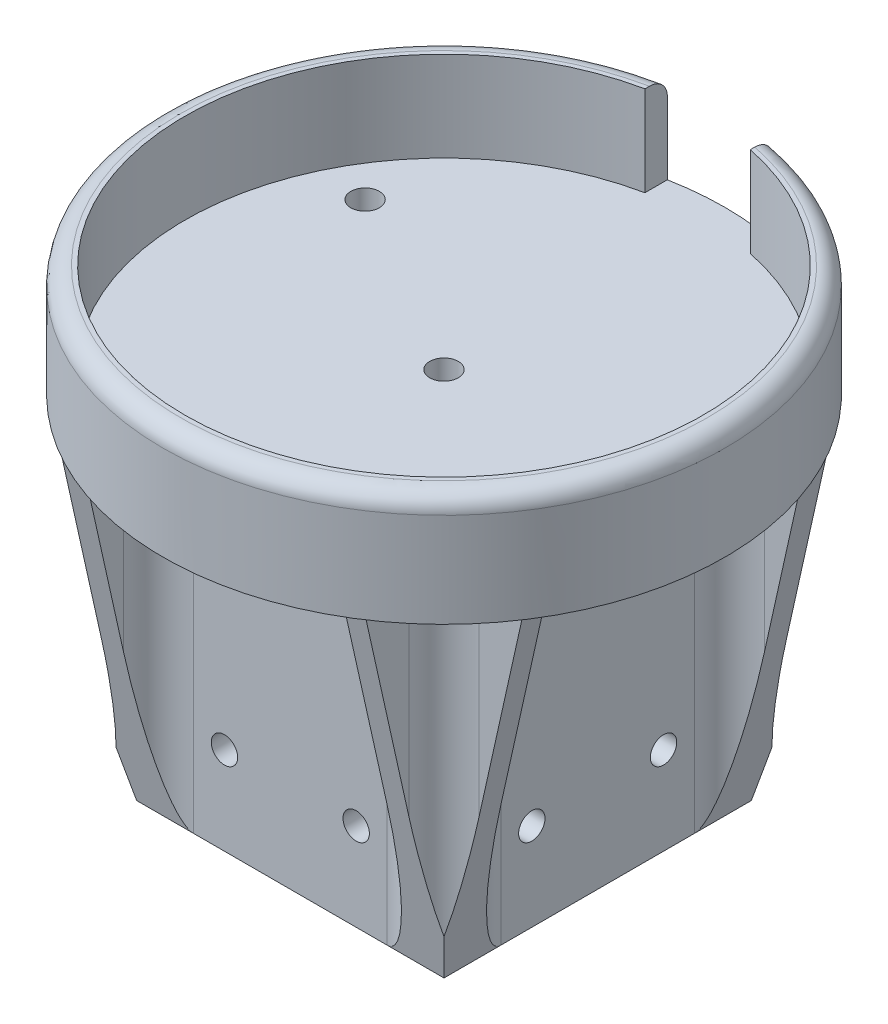
from build123d import *

# Parameters (mm, degrees)
SKETCH_3_W                         = 70
SKETCH_3_H                         = 70
EXTRUDE_2_DEPTH                    = 80
SKETCH_5_W                         = 60
SKETCH_5_H                         = 60
CUT_EXTRUDE_2_DEPTH                = 80
SKETCH_6_R                         = 3.25
CUT_EXTRUDE_3_DEPTH                = 80
SKETCH_7_R                         = 3
CUT_EXTRUDE_4_DEPTH                = 143.467540163
RIB_13_REACH                       = 144.468
SKETCH_13_WALL_W                   = 368.901142734
SKETCH_13_WALL_H                   = 5
PATTERN_CIRCULAR_1_COUNT           = 4
PATTERN_CIRCULAR_1_COPY_1_REACH    = 144.468
PATTERN_CIRCULAR_1_COPY_1_SKETCH_W = 368.901142734
PATTERN_CIRCULAR_1_COPY_1_SKETCH_H = 5
PATTERN_CIRCULAR_1_COPY_2_REACH    = 144.468
PATTERN_CIRCULAR_1_COPY_2_SKETCH_W = 368.901142734
PATTERN_CIRCULAR_1_COPY_2_SKETCH_H = 5
PATTERN_CIRCULAR_1_COPY_3_REACH    = 144.468
PATTERN_CIRCULAR_1_COPY_3_SKETCH_W = 368.901142734
PATTERN_CIRCULAR_1_COPY_3_SKETCH_H = 5
SKETCH_15_W                        = 24
SKETCH_15_H                        = 39.427435321
CUT_EXTRUDE_5_DEPTH                = 125.165212519
FILLET_2_R                         = 8
PATTERN_CIRCULAR_2_COUNT           = 4


with BuildPart() as part:
    # 草图2 → 旋转1 (revolve)
    with BuildSketch(Plane.XY, mode=Mode.PRIVATE) as revolve_1_sk:
        with BuildLine():
            Line((-64, 5), (-64, 21.5))
            ThreePointArc((-64, 21.5), (-62.828427125, 24.328427125), (-60, 25.5))
            Line((-60, 25.5), (-59, 25.5))
            Line((-59, 25.5), (-59, 5))
            Line((-59, 5), (0, 5))
            Line((0, 5), (0, 0))
            Line((0, 0), (-64, 0))
            Line((-64, 0), (-64, 5))
        make_face()
    revolve(revolve_1_sk.sketch.rotate(Axis((0, 0, 0), (0, 1, 0)), 270), axis=Axis((0, 0, 0), (0, 1, 0)))

    # 草图3 → 凸台-拉伸2 (add)
    with BuildSketch(Plane.XZ):
        Rectangle(SKETCH_3_W, SKETCH_3_H)
    extrude(amount=EXTRUDE_2_DEPTH)

    # 草图5 → 切除-拉伸2 (cut)
    with BuildSketch(Plane.XZ.offset(80)):
        Rectangle(SKETCH_5_W, SKETCH_5_H)
    extrude(amount=-CUT_EXTRUDE_2_DEPTH, mode=Mode.SUBTRACT)

    # 草图6 → 切除-拉伸3 (cut)
    with BuildSketch(Plane(origin=(0, 5, 0), x_dir=(1, 0, 0), z_dir=(0, 1, 0))):
        with Locations(Location((0, 0, 0), (0, 0, 270))):
            Circle(SKETCH_6_R)
        with Locations(Location((0, -49.1, 0), (0, 0, 270))):
            Circle(SKETCH_6_R)
        with Locations(Location((-42.521847326, 24.55, 0), (0, 0, 270))):
            Circle(SKETCH_6_R)
        with Locations(Location((42.521847326, 24.55, 0), (0, 0, 270))):
            Circle(SKETCH_6_R)
    extrude(amount=-CUT_EXTRUDE_3_DEPTH, mode=Mode.SUBTRACT)

    # 草图7 → 切除-拉伸4 (cut, symmetric)
    with BuildSketch(Plane.XY.offset(35)):
        with Locations((-15, -60)):
            Circle(SKETCH_7_R)
        with Locations((-15, -15)):
            Circle(SKETCH_7_R)
        with Locations((15, -15)):
            Circle(SKETCH_7_R)
        with Locations((15, -60)):
            Circle(SKETCH_7_R)
    cut_extrude_4 = extrude(amount=CUT_EXTRUDE_4_DEPTH, both=True, mode=Mode.SUBTRACT)

    # 草图13 wall → 筋13 (add, up to next)
    with BuildSketch(Plane(origin=(43.922378982, -40, -35), x_dir=(0.217709103495, 0.976013701879, 0), z_dir=(0.976013701879, -0.217709103495, 0)), mode=Mode.PRIVATE) as rib_13_sk1:
        with Locations((0, 2.5)):
            Rectangle(SKETCH_13_WALL_W, SKETCH_13_WALL_H)
    rib_13_tool1 = extrude(rib_13_sk1.sketch, amount=-RIB_13_REACH, mode=Mode.PRIVATE) - part.part
    rib_13 = rib_13_tool1.solids().sort_by_distance((43.922378982, -40, -35))[0]
    add(rib_13)

    # 镜向2: 筋13 across plane
    add(rib_13.mirror(Plane.XY))

    # 阵列(圆周)1: 筋13 ×4 about axis
    pattern_circular_1_axis = Axis((0, 0, 0), (0, 1, 0))
    for i in range(1, PATTERN_CIRCULAR_1_COUNT):
        add(rib_13.rotate(pattern_circular_1_axis, i * 360 / PATTERN_CIRCULAR_1_COUNT))

    # 阵列(圆周)1 copy 1 sketch → 阵列(圆周)1 copy 1 (add, up to next)
    with BuildSketch(Plane(origin=(35, -40, -43.922378982), x_dir=(0, 0.976013701879, -0.217709103495), z_dir=(0, -0.217709103495, -0.976013701879)), mode=Mode.PRIVATE) as pattern_circular_1_copy_1_sk1:
        with Locations((0, -2.5)):
            Rectangle(PATTERN_CIRCULAR_1_COPY_1_SKETCH_W, PATTERN_CIRCULAR_1_COPY_1_SKETCH_H)
    pattern_circular_1_copy_1_tool1 = extrude(pattern_circular_1_copy_1_sk1.sketch, amount=-PATTERN_CIRCULAR_1_COPY_1_REACH, mode=Mode.PRIVATE) - part.part
    add(pattern_circular_1_copy_1_tool1.solids().sort_by_distance((35, -40, -43.922378982))[0])

    # 阵列(圆周)1 copy 2 sketch → 阵列(圆周)1 copy 2 (add, up to next)
    with BuildSketch(Plane(origin=(-43.922378982, -40, -35), x_dir=(-0.217709103495, 0.976013701879, 0), z_dir=(-0.976013701879, -0.217709103495, 0)), mode=Mode.PRIVATE) as pattern_circular_1_copy_2_sk1:
        with Locations((0, -2.5)):
            Rectangle(PATTERN_CIRCULAR_1_COPY_2_SKETCH_W, PATTERN_CIRCULAR_1_COPY_2_SKETCH_H)
    pattern_circular_1_copy_2_tool1 = extrude(pattern_circular_1_copy_2_sk1.sketch, amount=-PATTERN_CIRCULAR_1_COPY_2_REACH, mode=Mode.PRIVATE) - part.part
    add(pattern_circular_1_copy_2_tool1.solids().sort_by_distance((-43.922378982, -40, -35))[0])

    # 阵列(圆周)1 copy 3 sketch → 阵列(圆周)1 copy 3 (add, up to next)
    with BuildSketch(Plane(origin=(-35, -40, 43.922378982), x_dir=(0, 0.976013701879, 0.217709103495), z_dir=(0, -0.217709103495, 0.976013701879)), mode=Mode.PRIVATE) as pattern_circular_1_copy_3_sk1:
        with Locations((0, -2.5)):
            Rectangle(PATTERN_CIRCULAR_1_COPY_3_SKETCH_W, PATTERN_CIRCULAR_1_COPY_3_SKETCH_H)
    pattern_circular_1_copy_3_tool1 = extrude(pattern_circular_1_copy_3_sk1.sketch, amount=-PATTERN_CIRCULAR_1_COPY_3_REACH, mode=Mode.PRIVATE) - part.part
    add(pattern_circular_1_copy_3_tool1.solids().sort_by_distance((-35, -40, 43.922378982))[0])

    # 草图15 → 切除-拉伸5 (cut, through all)
    with BuildSketch(Plane(origin=(0, 5, 0), x_dir=(1, 0, 0), z_dir=(0, 1, 0))):
        with Locations((0, 54.558696029)):
            Rectangle(SKETCH_15_W, SKETCH_15_H)
    extrude(amount=CUT_EXTRUDE_5_DEPTH, mode=Mode.SUBTRACT)

    # 圆角2
    # the kernel refuses this fillet: 8 mm, written as the material it adds along each edge
    with BuildSketch(Plane(origin=(35, 0, -30), x_dir=(0, 0, 1), z_dir=(0, -1, 0))) as fillet_2_piece_1_section:
        with BuildLine():
            CenterArc((FILLET_2_R, -FILLET_2_R), FILLET_2_R, 90, 90)
            Line((0, -FILLET_2_R), (0, 0))
            Line((0, 0), (FILLET_2_R, 0))
        make_face()
    fillet_2_piece_1 = extrude(amount=80, mode=Mode.PRIVATE)
    fillet_2_piece_1 = split(fillet_2_piece_1, bisect_by=Plane(origin=(44.354586475, -38.062366579, -28.080040712), z_dir=(-0.9760137018789288, 0.2177091034949841, 0)), keep=Keep.TOP, mode=Mode.PRIVATE)
    add(fillet_2_piece_1)
    with BuildSketch(Plane(origin=(35, 0, 30), x_dir=(0, 0, -1), z_dir=(0, -1, 0))) as fillet_2_piece_2_section:
        with BuildLine():
            CenterArc((FILLET_2_R, FILLET_2_R), FILLET_2_R, 180, 90)
            Line((0, FILLET_2_R), (0, 0))
            Line((0, 0), (FILLET_2_R, 0))
        make_face()
    fillet_2_piece_2 = extrude(amount=80, mode=Mode.PRIVATE)
    fillet_2_piece_2 = split(fillet_2_piece_2, bisect_by=Plane(origin=(44.354586475, -38.062366579, 28.080040712), z_dir=(-0.9760137018789288, 0.2177091034949841, 0)), keep=Keep.TOP, mode=Mode.PRIVATE)
    add(fillet_2_piece_2)
    with BuildSketch(Plane(origin=(30, 0, -35), x_dir=(-1, 0, 0), z_dir=(0, -1, 0))) as fillet_2_piece_3_section:
        with BuildLine():
            CenterArc((FILLET_2_R, FILLET_2_R), FILLET_2_R, 180, 90)
            Line((0, FILLET_2_R), (0, 0))
            Line((0, 0), (FILLET_2_R, 0))
        make_face()
    fillet_2_piece_3 = extrude(amount=80, mode=Mode.PRIVATE)
    fillet_2_piece_3 = split(fillet_2_piece_3, bisect_by=Plane(origin=(28.080040712, -38.062366579, -44.354586475), z_dir=(0, 0.2177091034949841, 0.9760137018789288)), keep=Keep.TOP, mode=Mode.PRIVATE)
    add(fillet_2_piece_3)
    with BuildSketch(Plane(origin=(35, -100, -35), x_dir=(0, 0, -1), z_dir=(0, 1, 0))) as fillet_2_piece_4_section:
        with BuildLine():
            CenterArc((FILLET_2_R, -FILLET_2_R), FILLET_2_R, 90, 90)
            Line((0, -FILLET_2_R), (0, 0))
            Line((0, 0), (FILLET_2_R, 0))
        make_face()
    fillet_2_piece_4 = extrude(amount=100, mode=Mode.PRIVATE)
    fillet_2_piece_4 = split(fillet_2_piece_4, bisect_by=Plane(origin=(36.730940637, -35.444045901, -44.938627709), z_dir=(0, 0.2177091034949841, 0.9760137018789288)), keep=Keep.TOP, mode=Mode.PRIVATE)
    fillet_2_piece_4 = split(fillet_2_piece_4, bisect_by=Plane(origin=(44.938627709, -35.444045901, -36.730940637), z_dir=(-0.9760137018789288, 0.2177091034949841, 0)), keep=Keep.TOP, mode=Mode.PRIVATE)
    add(fillet_2_piece_4)
    with BuildSketch(Plane(origin=(-35, 0, -30), x_dir=(0, 0, 1), z_dir=(0, -1, 0))) as fillet_2_piece_5_section:
        with BuildLine():
            CenterArc((FILLET_2_R, FILLET_2_R), FILLET_2_R, 180, 90)
            Line((0, FILLET_2_R), (0, 0))
            Line((0, 0), (FILLET_2_R, 0))
        make_face()
    fillet_2_piece_5 = extrude(amount=80, mode=Mode.PRIVATE)
    fillet_2_piece_5 = split(fillet_2_piece_5, bisect_by=Plane(origin=(-44.354586475, -38.062366579, -28.080040712), z_dir=(0.9760137018789288, 0.2177091034949841, 0)), keep=Keep.TOP, mode=Mode.PRIVATE)
    add(fillet_2_piece_5)
    with BuildSketch(Plane(origin=(-30, 0, 35), x_dir=(1, 0, 0), z_dir=(0, -1, 0))) as fillet_2_piece_6_section:
        with BuildLine():
            CenterArc((FILLET_2_R, FILLET_2_R), FILLET_2_R, 180, 90)
            Line((0, FILLET_2_R), (0, 0))
            Line((0, 0), (FILLET_2_R, 0))
        make_face()
    fillet_2_piece_6 = extrude(amount=80, mode=Mode.PRIVATE)
    fillet_2_piece_6 = split(fillet_2_piece_6, bisect_by=Plane(origin=(-28.080040712, -38.062366579, 44.354586475), z_dir=(0, 0.2177091034949841, -0.9760137018789288)), keep=Keep.TOP, mode=Mode.PRIVATE)
    add(fillet_2_piece_6)
    with BuildSketch(Plane(origin=(-30, 0, -35), x_dir=(0, 0, -1), z_dir=(0, -1, 0))) as fillet_2_piece_7_section:
        with BuildLine():
            CenterArc((FILLET_2_R, FILLET_2_R), FILLET_2_R, 180, 90)
            Line((0, FILLET_2_R), (0, 0))
            Line((0, 0), (FILLET_2_R, 0))
        make_face()
    fillet_2_piece_7 = extrude(amount=80, mode=Mode.PRIVATE)
    fillet_2_piece_7 = split(fillet_2_piece_7, bisect_by=Plane(origin=(-28.080040712, -38.062366579, -44.354586475), z_dir=(0, 0.2177091034949841, 0.9760137018789288)), keep=Keep.TOP, mode=Mode.PRIVATE)
    add(fillet_2_piece_7)
    with BuildSketch(Plane(origin=(-35, -100, -35), x_dir=(-1, 0, 0), z_dir=(0, 1, 0))) as fillet_2_piece_8_section:
        with BuildLine():
            CenterArc((FILLET_2_R, -FILLET_2_R), FILLET_2_R, 90, 90)
            Line((0, -FILLET_2_R), (0, 0))
            Line((0, 0), (FILLET_2_R, 0))
        make_face()
    fillet_2_piece_8 = extrude(amount=100, mode=Mode.PRIVATE)
    fillet_2_piece_8 = split(fillet_2_piece_8, bisect_by=Plane(origin=(-44.938627709, -35.444045901, -36.730940637), z_dir=(0.9760137018789288, 0.2177091034949841, 0)), keep=Keep.TOP, mode=Mode.PRIVATE)
    fillet_2_piece_8 = split(fillet_2_piece_8, bisect_by=Plane(origin=(-36.730940637, -35.444045901, -44.938627709), z_dir=(0, 0.2177091034949841, 0.9760137018789288)), keep=Keep.TOP, mode=Mode.PRIVATE)
    add(fillet_2_piece_8)
    with BuildSketch(Plane(origin=(-35, 0, 30), x_dir=(-1, 0, 0), z_dir=(0, -1, 0))) as fillet_2_piece_9_section:
        with BuildLine():
            CenterArc((FILLET_2_R, FILLET_2_R), FILLET_2_R, 180, 90)
            Line((0, FILLET_2_R), (0, 0))
            Line((0, 0), (FILLET_2_R, 0))
        make_face()
    fillet_2_piece_9 = extrude(amount=80, mode=Mode.PRIVATE)
    fillet_2_piece_9 = split(fillet_2_piece_9, bisect_by=Plane(origin=(-44.354586475, -38.062366579, 28.080040712), z_dir=(0.9760137018789288, 0.2177091034949841, 0)), keep=Keep.TOP, mode=Mode.PRIVATE)
    add(fillet_2_piece_9)
    with BuildSketch(Plane(origin=(-35, -100, 35), x_dir=(0, 0, 1), z_dir=(0, 1, 0))) as fillet_2_piece_10_section:
        with BuildLine():
            CenterArc((FILLET_2_R, -FILLET_2_R), FILLET_2_R, 90, 90)
            Line((0, -FILLET_2_R), (0, 0))
            Line((0, 0), (FILLET_2_R, 0))
        make_face()
    fillet_2_piece_10 = extrude(amount=100, mode=Mode.PRIVATE)
    fillet_2_piece_10 = split(fillet_2_piece_10, bisect_by=Plane(origin=(-36.730940637, -35.444045901, 44.938627709), z_dir=(0, 0.2177091034949841, -0.9760137018789288)), keep=Keep.TOP, mode=Mode.PRIVATE)
    fillet_2_piece_10 = split(fillet_2_piece_10, bisect_by=Plane(origin=(-44.938627709, -35.444045901, 36.730940637), z_dir=(0.9760137018789288, 0.2177091034949841, 0)), keep=Keep.TOP, mode=Mode.PRIVATE)
    add(fillet_2_piece_10)
    with BuildSketch(Plane(origin=(30, 0, 35), x_dir=(0, 0, 1), z_dir=(0, -1, 0))) as fillet_2_piece_11_section:
        with BuildLine():
            CenterArc((FILLET_2_R, FILLET_2_R), FILLET_2_R, 180, 90)
            Line((0, FILLET_2_R), (0, 0))
            Line((0, 0), (FILLET_2_R, 0))
        make_face()
    fillet_2_piece_11 = extrude(amount=80, mode=Mode.PRIVATE)
    fillet_2_piece_11 = split(fillet_2_piece_11, bisect_by=Plane(origin=(28.080040712, -38.062366579, 44.354586475), z_dir=(0, 0.2177091034949841, -0.9760137018789288)), keep=Keep.TOP, mode=Mode.PRIVATE)
    add(fillet_2_piece_11)
    with BuildSketch(Plane(origin=(35, 0, 35), x_dir=(1, 0, 0), z_dir=(0, -1, 0))) as fillet_2_piece_12_section:
        with BuildLine():
            CenterArc((FILLET_2_R, FILLET_2_R), FILLET_2_R, 180, 90)
            Line((0, FILLET_2_R), (0, 0))
            Line((0, 0), (FILLET_2_R, 0))
        make_face()
    fillet_2_piece_12 = extrude(amount=100, mode=Mode.PRIVATE)
    fillet_2_piece_12 = split(fillet_2_piece_12, bisect_by=Plane(origin=(44.938627709, -35.444045901, 36.730940637), z_dir=(-0.9760137018789288, 0.2177091034949841, 0)), keep=Keep.TOP, mode=Mode.PRIVATE)
    fillet_2_piece_12 = split(fillet_2_piece_12, bisect_by=Plane(origin=(36.730940637, -35.444045901, 44.938627709), z_dir=(0, 0.2177091034949841, -0.9760137018789288)), keep=Keep.TOP, mode=Mode.PRIVATE)
    add(fillet_2_piece_12)

    # 阵列(圆周)2: 切除-拉伸4 ×4 about axis
    pattern_circular_2_axis = Axis((0, 0, 0), (0, -1, 0))
    for i in range(1, PATTERN_CIRCULAR_2_COUNT):
        add(cut_extrude_4.rotate(pattern_circular_2_axis, i * 360 / PATTERN_CIRCULAR_2_COUNT), mode=Mode.SUBTRACT)


solid = part.part
